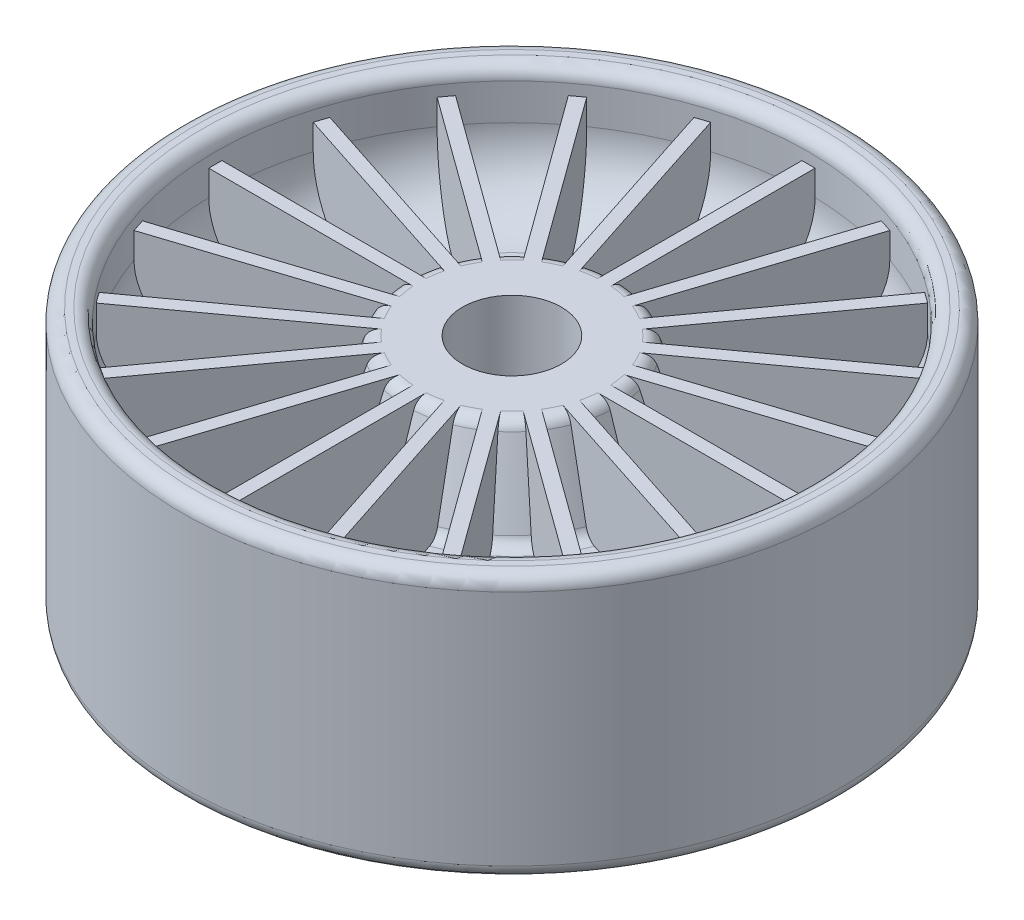
from build123d import *

# Parameters (mm, degrees)
FILLET1_R                    = 2.54
FILLET2_R                    = 12.7
RIB1_REACH                   = 102.973
SKETCH4_WALLS_W              = 2.54
SKETCH4_WALLS_H              = 221.151221797
CIRPATTERN1_COUNT            = 20
CIRPATTERN1_COPY_1_REACH     = 102.973
CIRPATTERN1_COPY_1_SKETCH_W  = 2.54
CIRPATTERN1_COPY_1_SKETCH_H  = 221.151221797
CIRPATTERN1_COPY_2_REACH     = 102.973
CIRPATTERN1_COPY_2_SKETCH_W  = 2.54
CIRPATTERN1_COPY_2_SKETCH_H  = 221.151221797
CIRPATTERN1_COPY_3_REACH     = 102.973
CIRPATTERN1_COPY_3_SKETCH_W  = 2.54
CIRPATTERN1_COPY_3_SKETCH_H  = 221.151221797
CIRPATTERN1_COPY_4_REACH     = 102.973
CIRPATTERN1_COPY_4_SKETCH_W  = 2.54
CIRPATTERN1_COPY_4_SKETCH_H  = 221.151221797
CIRPATTERN1_COPY_5_REACH     = 102.973
CIRPATTERN1_COPY_5_SKETCH_W  = 2.54
CIRPATTERN1_COPY_5_SKETCH_H  = 221.151221797
CIRPATTERN1_COPY_6_REACH     = 102.973
CIRPATTERN1_COPY_6_SKETCH_W  = 2.54
CIRPATTERN1_COPY_6_SKETCH_H  = 221.151221797
CIRPATTERN1_COPY_7_REACH     = 102.973
CIRPATTERN1_COPY_7_SKETCH_W  = 2.54
CIRPATTERN1_COPY_7_SKETCH_H  = 221.151221797
CIRPATTERN1_COPY_8_REACH     = 102.973
CIRPATTERN1_COPY_8_SKETCH_W  = 2.54
CIRPATTERN1_COPY_8_SKETCH_H  = 221.151221797
CIRPATTERN1_COPY_9_REACH     = 102.973
CIRPATTERN1_COPY_9_SKETCH_W  = 2.54
CIRPATTERN1_COPY_9_SKETCH_H  = 221.151221797
CIRPATTERN1_COPY_10_REACH    = 102.973
CIRPATTERN1_COPY_10_SKETCH_W = 2.54
CIRPATTERN1_COPY_10_SKETCH_H = 221.151221797
CIRPATTERN1_COPY_11_REACH    = 102.973
CIRPATTERN1_COPY_11_SKETCH_W = 2.54
CIRPATTERN1_COPY_11_SKETCH_H = 221.151221797
CIRPATTERN1_COPY_12_REACH    = 102.973
CIRPATTERN1_COPY_12_SKETCH_W = 2.54
CIRPATTERN1_COPY_12_SKETCH_H = 221.151221797
CIRPATTERN1_COPY_13_REACH    = 102.973
CIRPATTERN1_COPY_13_SKETCH_W = 2.54
CIRPATTERN1_COPY_13_SKETCH_H = 221.151221797
CIRPATTERN1_COPY_14_REACH    = 102.973
CIRPATTERN1_COPY_14_SKETCH_W = 2.54
CIRPATTERN1_COPY_14_SKETCH_H = 221.151221797
CIRPATTERN1_COPY_15_REACH    = 102.973
CIRPATTERN1_COPY_15_SKETCH_W = 2.54
CIRPATTERN1_COPY_15_SKETCH_H = 221.151221797
CIRPATTERN1_COPY_16_REACH    = 102.973
CIRPATTERN1_COPY_16_SKETCH_W = 2.54
CIRPATTERN1_COPY_16_SKETCH_H = 221.151221797
CIRPATTERN1_COPY_17_REACH    = 102.973
CIRPATTERN1_COPY_17_SKETCH_W = 2.54
CIRPATTERN1_COPY_17_SKETCH_H = 221.151221797
CIRPATTERN1_COPY_18_REACH    = 102.973
CIRPATTERN1_COPY_18_SKETCH_W = 2.54
CIRPATTERN1_COPY_18_SKETCH_H = 221.151221797
CIRPATTERN1_COPY_19_REACH    = 102.973
CIRPATTERN1_COPY_19_SKETCH_W = 2.54
CIRPATTERN1_COPY_19_SKETCH_H = 221.151221797


with BuildPart() as part:
    # Sketch2 → Revolve2 (revolve)
    with BuildSketch(Plane.XY):
        Polygon((-9.525, -20.763961415), (-9.525, 20.763961415), (-19.685, 20.763961415), (-25.4, 3.175), (-57.15, 3.175), (-57.15, 25.4), (-63.5, 25.4), (-63.5, -25.4), (-57.15, -25.4), (-57.15, -3.175), (-25.4, -3.175), (-19.685, -20.763961415), align=None)
    revolve(axis=Axis((0, 0, 0), (0, 1, 0)))

    # Fillet1
    fillet1_edges = [part.edges().sort_by_distance(p)[0] for p in [
        (19.685, -20.763961415, 0),
        (25.4, -3.175, 0),
        (19.685, 20.763961415, 0),
        (25.4, 3.175, 0),
        (63.5, -25.4, 0),
        (57.15, 25.4, 0),
        (63.5, 25.4, 0),
        (57.15, -25.4, 0),
    ]]
    fillet(fillet1_edges, radius=FILLET1_R)

    # Fillet2
    fillet2_edges = [part.edges().sort_by_distance(p)[0] for p in [
        (57.15, -3.175, 0),
        (57.15, 3.175, 0),
    ]]
    fillet(fillet2_edges, radius=FILLET2_R)

    # Sketch4 walls → Rib1 (add, up to next)
    with BuildSketch(Plane(origin=(0, 20.763961415, 0), x_dir=(1, 0, 0), z_dir=(0, 1, 0)), mode=Mode.PRIVATE) as rib1_sk1:
        with Locations((0, 35.847709011)):
            Rectangle(SKETCH4_WALLS_W, SKETCH4_WALLS_H)
    rib1_tool1 = extrude(rib1_sk1.sketch, amount=-RIB1_REACH, mode=Mode.PRIVATE) - part.part
    rib1 = rib1_tool1.solids().sort_by_distance((0, 20.763961415, -35.847709011))[0]
    add(rib1)

    # Mirror1: Rib1 across plane
    add(rib1.mirror(Plane.ZX))

    # CirPattern1: Rib1 ×20 about axis
    cirpattern1_axis = Axis((0, 0, 0), (0, -1, 0))
    for i in range(1, CIRPATTERN1_COUNT):
        add(rib1.rotate(cirpattern1_axis, i * 360 / CIRPATTERN1_COUNT))

    # CirPattern1 copy 1 sketch → CirPattern1 copy 1 (add, up to next)
    with BuildSketch(Plane(origin=(0, -20.763961415, 0), x_dir=(0.9510565162951535, 0, 0.3090169943749474), z_dir=(0, -1, 0)), mode=Mode.PRIVATE) as cirpattern1_copy_1_sk1:
        with Locations((0, -35.847709011)):
            Rectangle(CIRPATTERN1_COPY_1_SKETCH_W, CIRPATTERN1_COPY_1_SKETCH_H)
    cirpattern1_copy_1_tool1 = extrude(cirpattern1_copy_1_sk1.sketch, amount=-CIRPATTERN1_COPY_1_REACH, mode=Mode.PRIVATE) - part.part
    add(cirpattern1_copy_1_tool1.solids().sort_by_distance((11.077551294, -20.763961415, -34.093197249))[0])

    # CirPattern1 copy 2 sketch → CirPattern1 copy 2 (add, up to next)
    with BuildSketch(Plane(origin=(0, -20.763961415, 0), x_dir=(0.8090169943749475, 0, 0.5877852522924731), z_dir=(0, -1, 0)), mode=Mode.PRIVATE) as cirpattern1_copy_2_sk1:
        with Locations((0, -35.847709011)):
            Rectangle(CIRPATTERN1_COPY_2_SKETCH_W, CIRPATTERN1_COPY_2_SKETCH_H)
    cirpattern1_copy_2_tool1 = extrude(cirpattern1_copy_2_sk1.sketch, amount=-CIRPATTERN1_COPY_2_REACH, mode=Mode.PRIVATE) - part.part
    add(cirpattern1_copy_2_tool1.solids().sort_by_distance((21.070754685, -20.763961415, -29.001405799))[0])

    # CirPattern1 copy 3 sketch → CirPattern1 copy 3 (add, up to next)
    with BuildSketch(Plane(origin=(0, -20.763961415, 0), x_dir=(0.5877852522924731, 0, 0.8090169943749475), z_dir=(0, -1, 0)), mode=Mode.PRIVATE) as cirpattern1_copy_3_sk1:
        with Locations((0, -35.847709011)):
            Rectangle(CIRPATTERN1_COPY_3_SKETCH_W, CIRPATTERN1_COPY_3_SKETCH_H)
    cirpattern1_copy_3_tool1 = extrude(cirpattern1_copy_3_sk1.sketch, amount=-CIRPATTERN1_COPY_3_REACH, mode=Mode.PRIVATE) - part.part
    add(cirpattern1_copy_3_tool1.solids().sort_by_distance((29.001405799, -20.763961415, -21.070754685))[0])

    # CirPattern1 copy 4 sketch → CirPattern1 copy 4 (add, up to next)
    with BuildSketch(Plane(origin=(0, -20.763961415, 0), x_dir=(0.30901699437494745, 0, 0.9510565162951535), z_dir=(0, -1, 0)), mode=Mode.PRIVATE) as cirpattern1_copy_4_sk1:
        with Locations((0, -35.847709011)):
            Rectangle(CIRPATTERN1_COPY_4_SKETCH_W, CIRPATTERN1_COPY_4_SKETCH_H)
    cirpattern1_copy_4_tool1 = extrude(cirpattern1_copy_4_sk1.sketch, amount=-CIRPATTERN1_COPY_4_REACH, mode=Mode.PRIVATE) - part.part
    add(cirpattern1_copy_4_tool1.solids().sort_by_distance((34.093197249, -20.763961415, -11.077551294))[0])

    # CirPattern1 copy 5 sketch → CirPattern1 copy 5 (add, up to next)
    with BuildSketch(Plane(origin=(0, -20.763961415, 0), x_dir=(0, 0, 1), z_dir=(0, -1, 0)), mode=Mode.PRIVATE) as cirpattern1_copy_5_sk1:
        with Locations((0, -35.847709011)):
            Rectangle(CIRPATTERN1_COPY_5_SKETCH_W, CIRPATTERN1_COPY_5_SKETCH_H)
    cirpattern1_copy_5_tool1 = extrude(cirpattern1_copy_5_sk1.sketch, amount=-CIRPATTERN1_COPY_5_REACH, mode=Mode.PRIVATE) - part.part
    add(cirpattern1_copy_5_tool1.solids().sort_by_distance((35.847709011, -20.763961415, 0))[0])

    # CirPattern1 copy 6 sketch → CirPattern1 copy 6 (add, up to next)
    with BuildSketch(Plane(origin=(0, -20.763961415, 0), x_dir=(-0.30901699437494734, 0, 0.9510565162951536), z_dir=(0, -1, 0)), mode=Mode.PRIVATE) as cirpattern1_copy_6_sk1:
        with Locations((0, -35.847709011)):
            Rectangle(CIRPATTERN1_COPY_6_SKETCH_W, CIRPATTERN1_COPY_6_SKETCH_H)
    cirpattern1_copy_6_tool1 = extrude(cirpattern1_copy_6_sk1.sketch, amount=-CIRPATTERN1_COPY_6_REACH, mode=Mode.PRIVATE) - part.part
    add(cirpattern1_copy_6_tool1.solids().sort_by_distance((34.093197249, -20.763961415, 11.077551294))[0])

    # CirPattern1 copy 7 sketch → CirPattern1 copy 7 (add, up to next)
    with BuildSketch(Plane(origin=(0, -20.763961415, 0), x_dir=(-0.587785252292473, 0, 0.8090169943749475), z_dir=(0, -1, 0)), mode=Mode.PRIVATE) as cirpattern1_copy_7_sk1:
        with Locations((0, -35.847709011)):
            Rectangle(CIRPATTERN1_COPY_7_SKETCH_W, CIRPATTERN1_COPY_7_SKETCH_H)
    cirpattern1_copy_7_tool1 = extrude(cirpattern1_copy_7_sk1.sketch, amount=-CIRPATTERN1_COPY_7_REACH, mode=Mode.PRIVATE) - part.part
    add(cirpattern1_copy_7_tool1.solids().sort_by_distance((29.001405799, -20.763961415, 21.070754685))[0])

    # CirPattern1 copy 8 sketch → CirPattern1 copy 8 (add, up to next)
    with BuildSketch(Plane(origin=(0, -20.763961415, 0), x_dir=(-0.8090169943749473, 0, 0.5877852522924732), z_dir=(0, -1, 0)), mode=Mode.PRIVATE) as cirpattern1_copy_8_sk1:
        with Locations((0, -35.847709011)):
            Rectangle(CIRPATTERN1_COPY_8_SKETCH_W, CIRPATTERN1_COPY_8_SKETCH_H)
    cirpattern1_copy_8_tool1 = extrude(cirpattern1_copy_8_sk1.sketch, amount=-CIRPATTERN1_COPY_8_REACH, mode=Mode.PRIVATE) - part.part
    add(cirpattern1_copy_8_tool1.solids().sort_by_distance((21.070754685, -20.763961415, 29.001405799))[0])

    # CirPattern1 copy 9 sketch → CirPattern1 copy 9 (add, up to next)
    with BuildSketch(Plane(origin=(0, -20.763961415, 0), x_dir=(-0.9510565162951535, 0, 0.3090169943749475), z_dir=(0, -1, 0)), mode=Mode.PRIVATE) as cirpattern1_copy_9_sk1:
        with Locations((0, -35.847709011)):
            Rectangle(CIRPATTERN1_COPY_9_SKETCH_W, CIRPATTERN1_COPY_9_SKETCH_H)
    cirpattern1_copy_9_tool1 = extrude(cirpattern1_copy_9_sk1.sketch, amount=-CIRPATTERN1_COPY_9_REACH, mode=Mode.PRIVATE) - part.part
    add(cirpattern1_copy_9_tool1.solids().sort_by_distance((11.077551294, -20.763961415, 34.093197249))[0])

    # CirPattern1 copy 10 sketch → CirPattern1 copy 10 (add, up to next)
    with BuildSketch(Plane(origin=(0, -20.763961415, 0), x_dir=(-1, 0, 0), z_dir=(0, -1, 0)), mode=Mode.PRIVATE) as cirpattern1_copy_10_sk1:
        with Locations((0, -35.847709011)):
            Rectangle(CIRPATTERN1_COPY_10_SKETCH_W, CIRPATTERN1_COPY_10_SKETCH_H)
    cirpattern1_copy_10_tool1 = extrude(cirpattern1_copy_10_sk1.sketch, amount=-CIRPATTERN1_COPY_10_REACH, mode=Mode.PRIVATE) - part.part
    add(cirpattern1_copy_10_tool1.solids().sort_by_distance((0, -20.763961415, 35.847709011))[0])

    # CirPattern1 copy 11 sketch → CirPattern1 copy 11 (add, up to next)
    with BuildSketch(Plane(origin=(0, -20.763961415, 0), x_dir=(-0.9510565162951536, 0, -0.3090169943749473), z_dir=(0, -1, 0)), mode=Mode.PRIVATE) as cirpattern1_copy_11_sk1:
        with Locations((0, -35.847709011)):
            Rectangle(CIRPATTERN1_COPY_11_SKETCH_W, CIRPATTERN1_COPY_11_SKETCH_H)
    cirpattern1_copy_11_tool1 = extrude(cirpattern1_copy_11_sk1.sketch, amount=-CIRPATTERN1_COPY_11_REACH, mode=Mode.PRIVATE) - part.part
    add(cirpattern1_copy_11_tool1.solids().sort_by_distance((-11.077551294, -20.763961415, 34.093197249))[0])

    # CirPattern1 copy 12 sketch → CirPattern1 copy 12 (add, up to next)
    with BuildSketch(Plane(origin=(0, -20.763961415, 0), x_dir=(-0.8090169943749476, 0, -0.587785252292473), z_dir=(0, -1, 0)), mode=Mode.PRIVATE) as cirpattern1_copy_12_sk1:
        with Locations((0, -35.847709011)):
            Rectangle(CIRPATTERN1_COPY_12_SKETCH_W, CIRPATTERN1_COPY_12_SKETCH_H)
    cirpattern1_copy_12_tool1 = extrude(cirpattern1_copy_12_sk1.sketch, amount=-CIRPATTERN1_COPY_12_REACH, mode=Mode.PRIVATE) - part.part
    add(cirpattern1_copy_12_tool1.solids().sort_by_distance((-21.070754685, -20.763961415, 29.001405799))[0])

    # CirPattern1 copy 13 sketch → CirPattern1 copy 13 (add, up to next)
    with BuildSketch(Plane(origin=(0, -20.763961415, 0), x_dir=(-0.5877852522924732, 0, -0.8090169943749473), z_dir=(0, -1, 0)), mode=Mode.PRIVATE) as cirpattern1_copy_13_sk1:
        with Locations((0, -35.847709011)):
            Rectangle(CIRPATTERN1_COPY_13_SKETCH_W, CIRPATTERN1_COPY_13_SKETCH_H)
    cirpattern1_copy_13_tool1 = extrude(cirpattern1_copy_13_sk1.sketch, amount=-CIRPATTERN1_COPY_13_REACH, mode=Mode.PRIVATE) - part.part
    add(cirpattern1_copy_13_tool1.solids().sort_by_distance((-29.001405799, -20.763961415, 21.070754685))[0])

    # CirPattern1 copy 14 sketch → CirPattern1 copy 14 (add, up to next)
    with BuildSketch(Plane(origin=(0, -20.763961415, 0), x_dir=(-0.30901699437494756, 0, -0.9510565162951535), z_dir=(0, -1, 0)), mode=Mode.PRIVATE) as cirpattern1_copy_14_sk1:
        with Locations((0, -35.847709011)):
            Rectangle(CIRPATTERN1_COPY_14_SKETCH_W, CIRPATTERN1_COPY_14_SKETCH_H)
    cirpattern1_copy_14_tool1 = extrude(cirpattern1_copy_14_sk1.sketch, amount=-CIRPATTERN1_COPY_14_REACH, mode=Mode.PRIVATE) - part.part
    add(cirpattern1_copy_14_tool1.solids().sort_by_distance((-34.093197249, -20.763961415, 11.077551294))[0])

    # CirPattern1 copy 15 sketch → CirPattern1 copy 15 (add, up to next)
    with BuildSketch(Plane(origin=(0, -20.763961415, 0), x_dir=(0, 0, -1), z_dir=(0, -1, 0)), mode=Mode.PRIVATE) as cirpattern1_copy_15_sk1:
        with Locations((0, -35.847709011)):
            Rectangle(CIRPATTERN1_COPY_15_SKETCH_W, CIRPATTERN1_COPY_15_SKETCH_H)
    cirpattern1_copy_15_tool1 = extrude(cirpattern1_copy_15_sk1.sketch, amount=-CIRPATTERN1_COPY_15_REACH, mode=Mode.PRIVATE) - part.part
    add(cirpattern1_copy_15_tool1.solids().sort_by_distance((-35.847709011, -20.763961415, 0))[0])

    # CirPattern1 copy 16 sketch → CirPattern1 copy 16 (add, up to next)
    with BuildSketch(Plane(origin=(0, -20.763961415, 0), x_dir=(0.30901699437494723, 0, -0.9510565162951536), z_dir=(0, -1, 0)), mode=Mode.PRIVATE) as cirpattern1_copy_16_sk1:
        with Locations((0, -35.847709011)):
            Rectangle(CIRPATTERN1_COPY_16_SKETCH_W, CIRPATTERN1_COPY_16_SKETCH_H)
    cirpattern1_copy_16_tool1 = extrude(cirpattern1_copy_16_sk1.sketch, amount=-CIRPATTERN1_COPY_16_REACH, mode=Mode.PRIVATE) - part.part
    add(cirpattern1_copy_16_tool1.solids().sort_by_distance((-34.093197249, -20.763961415, -11.077551294))[0])

    # CirPattern1 copy 17 sketch → CirPattern1 copy 17 (add, up to next)
    with BuildSketch(Plane(origin=(0, -20.763961415, 0), x_dir=(0.5877852522924729, 0, -0.8090169943749476), z_dir=(0, -1, 0)), mode=Mode.PRIVATE) as cirpattern1_copy_17_sk1:
        with Locations((0, -35.847709011)):
            Rectangle(CIRPATTERN1_COPY_17_SKETCH_W, CIRPATTERN1_COPY_17_SKETCH_H)
    cirpattern1_copy_17_tool1 = extrude(cirpattern1_copy_17_sk1.sketch, amount=-CIRPATTERN1_COPY_17_REACH, mode=Mode.PRIVATE) - part.part
    add(cirpattern1_copy_17_tool1.solids().sort_by_distance((-29.001405799, -20.763961415, -21.070754685))[0])

    # CirPattern1 copy 18 sketch → CirPattern1 copy 18 (add, up to next)
    with BuildSketch(Plane(origin=(0, -20.763961415, 0), x_dir=(0.8090169943749473, 0, -0.5877852522924734), z_dir=(0, -1, 0)), mode=Mode.PRIVATE) as cirpattern1_copy_18_sk1:
        with Locations((0, -35.847709011)):
            Rectangle(CIRPATTERN1_COPY_18_SKETCH_W, CIRPATTERN1_COPY_18_SKETCH_H)
    cirpattern1_copy_18_tool1 = extrude(cirpattern1_copy_18_sk1.sketch, amount=-CIRPATTERN1_COPY_18_REACH, mode=Mode.PRIVATE) - part.part
    add(cirpattern1_copy_18_tool1.solids().sort_by_distance((-21.070754685, -20.763961415, -29.001405799))[0])

    # CirPattern1 copy 19 sketch → CirPattern1 copy 19 (add, up to next)
    with BuildSketch(Plane(origin=(0, -20.763961415, 0), x_dir=(0.9510565162951535, 0, -0.3090169943749476), z_dir=(0, -1, 0)), mode=Mode.PRIVATE) as cirpattern1_copy_19_sk1:
        with Locations((0, -35.847709011)):
            Rectangle(CIRPATTERN1_COPY_19_SKETCH_W, CIRPATTERN1_COPY_19_SKETCH_H)
    cirpattern1_copy_19_tool1 = extrude(cirpattern1_copy_19_sk1.sketch, amount=-CIRPATTERN1_COPY_19_REACH, mode=Mode.PRIVATE) - part.part
    add(cirpattern1_copy_19_tool1.solids().sort_by_distance((-11.077551294, -20.763961415, -34.093197249))[0])


solid = part.part
